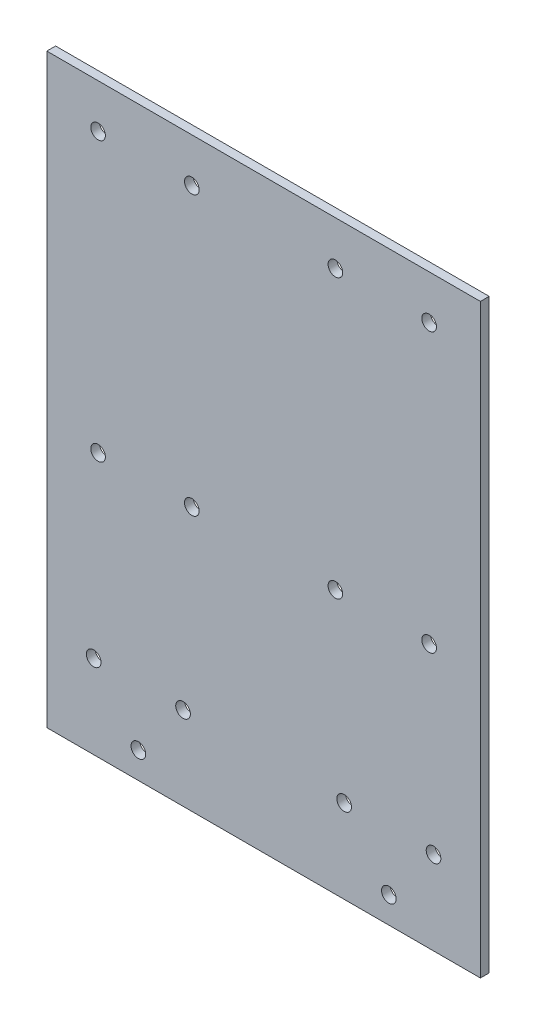
from build123d import *

# Parameters (mm, degrees)
SKETCH_1_W          = 148
SKETCH_1_H          = 200
SKETCH_1_R          = 2.5
EXTRUDE_1_DEPTH     = 3
SKETCH_2_R          = 2.5
CUT_EXTRUDE_1_DEPTH = 3


with BuildPart() as part:
    # 草图1 → 凸台-拉伸1 (new body)
    with BuildSketch(Plane.XY):
        Rectangle(SKETCH_1_W, SKETCH_1_H)
        with Locations((-58, -71.5)):
            Circle(SKETCH_1_R, mode=Mode.SUBTRACT)
        with Locations((-27.5, -71.5)):
            Circle(SKETCH_1_R, mode=Mode.SUBTRACT)
        with Locations((-42.75, -91)):
            Circle(SKETCH_1_R, mode=Mode.SUBTRACT)
        with Locations((42.75, -91)):
            Circle(SKETCH_1_R, mode=Mode.SUBTRACT)
        with Locations((58, -71.5)):
            Circle(SKETCH_1_R, mode=Mode.SUBTRACT)
        with Locations((27.5, -71.5)):
            Circle(SKETCH_1_R, mode=Mode.SUBTRACT)
    extrude(amount=EXTRUDE_1_DEPTH)

    # 草图2 → 切除-拉伸1 (cut)
    with BuildSketch(Plane.XY.offset(3)):
        with Locations((-56.5, -10)):
            Circle(SKETCH_2_R)
        with Locations((-24.5, -10)):
            Circle(SKETCH_2_R)
        with Locations((-56.5, 85)):
            Circle(SKETCH_2_R)
        with Locations((-24.5, 85)):
            Circle(SKETCH_2_R)
        with Locations((-56.5, 180)):
            Circle(SKETCH_2_R)
        with Locations((-24.5, 180)):
            Circle(SKETCH_2_R)
        with Locations((24.5, 180)):
            Circle(SKETCH_2_R)
        with Locations((56.5, 180)):
            Circle(SKETCH_2_R)
        with Locations((24.5, 85)):
            Circle(SKETCH_2_R)
        with Locations((56.5, 85)):
            Circle(SKETCH_2_R)
        with Locations((24.5, -10)):
            Circle(SKETCH_2_R)
        with Locations((56.5, -10)):
            Circle(SKETCH_2_R)
    extrude(amount=-CUT_EXTRUDE_1_DEPTH, mode=Mode.SUBTRACT)


solid = part.part
